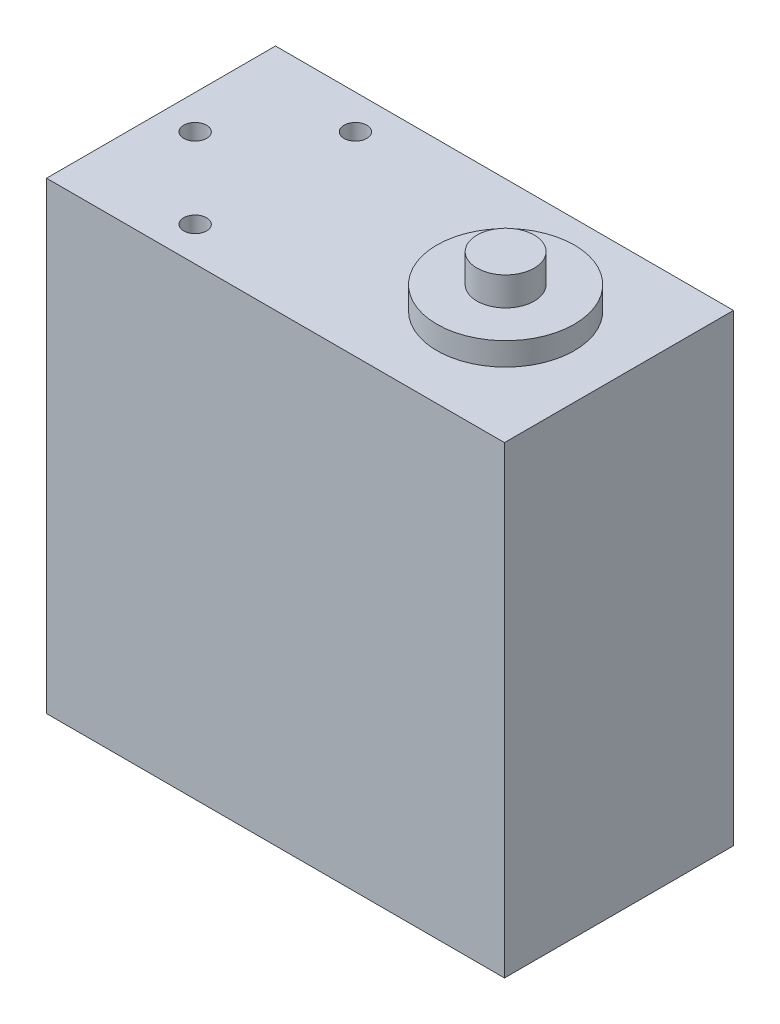
from build123d import *

# Parameters (mm, degrees)
SKETCH_1_W          = 40
SKETCH_1_H          = 40.5
EXTRUDE_1_DEPTH     = 20
SKETCH_2_R          = 6
EXTRUDE_2_DEPTH     = 2
SKETCH_4_R          = 2.5
EXTRUDE_3_DEPTH     = 2.5
EXTRUDE_START       = 2.5
SKETCH_5_R          = 2.5
EXTRUDE_4_DEPTH     = 2.5
SKETCH_6_R          = 1
CUT_EXTRUDE_1_DEPTH = 2.5
SKETCH_7_R          = 1
CUT_EXTRUDE_2_DEPTH = 2.5


with BuildPart() as part:
    # 草图1 → 凸台-拉伸1 (new body)
    with BuildSketch(Plane.XY):
        with Locations((20, 20.25)):
            Rectangle(SKETCH_1_W, SKETCH_1_H)
    extrude(amount=EXTRUDE_1_DEPTH)

    # 草图2 → 凸台-拉伸2 (add)
    with BuildSketch(Plane(origin=(0, 40.5, 0), x_dir=(1, 0, 0), z_dir=(0, 1, 0))):
        with Locations((30.1, -10)):
            Circle(SKETCH_2_R)
    extrude_2 = extrude(amount=EXTRUDE_2_DEPTH)

    # 镜向1: 凸台-拉伸2 across plane
    add(extrude_2.mirror(Plane.ZX.offset(20.25)))

    # 草图4 → 凸台-拉伸3 (add)
    with BuildSketch(Plane(origin=(0, 42.5, 0), x_dir=(1, 0, 0), z_dir=(0, 1, 0))):
        with Locations((30.1, -10)):
            Circle(SKETCH_4_R)
    extrude(amount=EXTRUDE_3_DEPTH)

    # 草图5 → 凸台-拉伸4 (add)
    with BuildSketch(Plane.XZ.offset(2).offset(EXTRUDE_START)):
        with Locations((30.1, 10)):
            Circle(SKETCH_5_R)
    extrude(amount=-EXTRUDE_4_DEPTH)

    # 草图6 → 切除-拉伸1 (cut)
    with BuildSketch(Plane(origin=(0, 40.5, 0), x_dir=(1, 0, 0), z_dir=(0, 1, 0))):
        with Locations((9.98, -3)):
            Circle(SKETCH_6_R)
        with Locations((9.98, -17)):
            Circle(SKETCH_6_R)
        with Locations((2.98, -10)):
            Circle(SKETCH_6_R)
    extrude(amount=-CUT_EXTRUDE_1_DEPTH, mode=Mode.SUBTRACT)

    # 草图7 → 切除-拉伸2 (cut)
    with BuildSketch(Plane.XZ):
        with Locations((2.5, 17.5)):
            Circle(SKETCH_7_R)
        with Locations((17.5, 17.5)):
            Circle(SKETCH_7_R)
        with Locations((17.5, 2.5)):
            Circle(SKETCH_7_R)
        with Locations((2.5, 2.5)):
            Circle(SKETCH_7_R)
    extrude(amount=-CUT_EXTRUDE_2_DEPTH, mode=Mode.SUBTRACT)


solid = part.part
